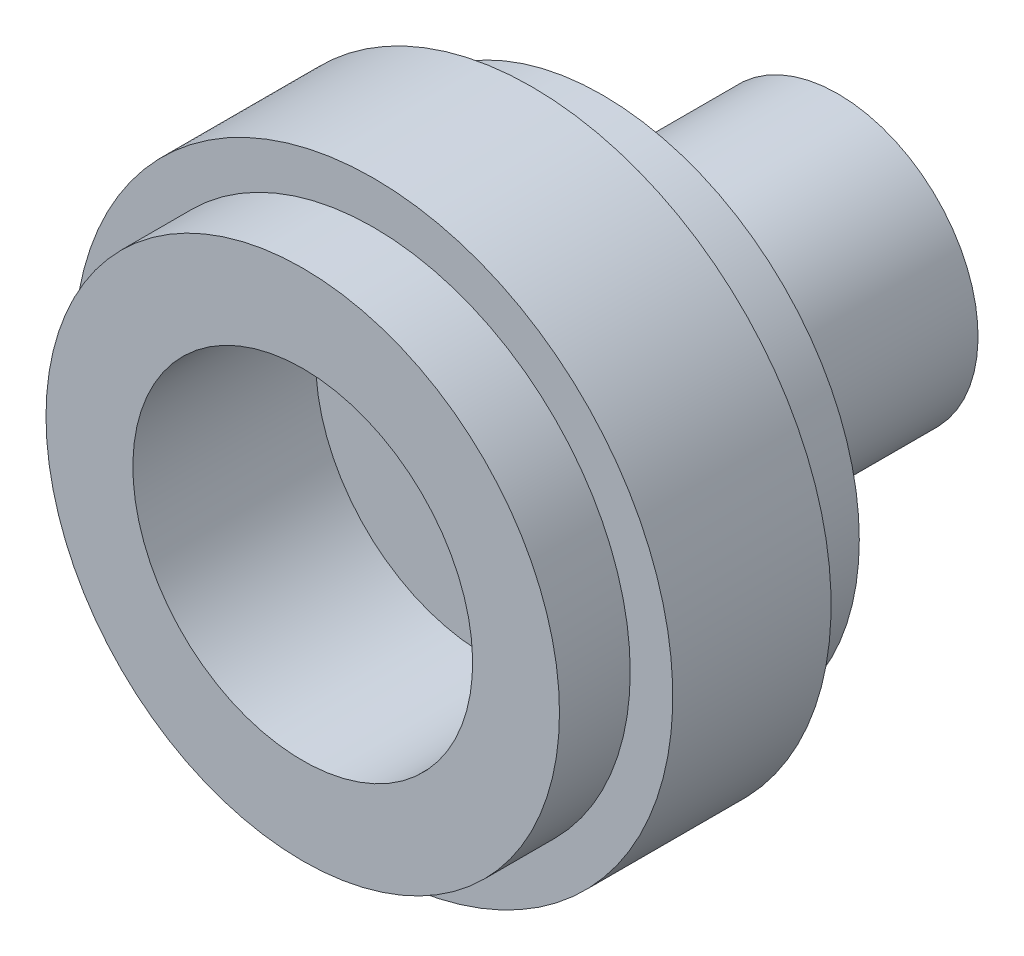
from build123d import *


with BuildPart() as part:
    # Sketch2 → Revolve1 (revolve)
    with BuildSketch(Plane(origin=(0, 0, 0), x_dir=(0, 0, -1), z_dir=(1, 0, 0))):
        Polygon((-5.4356, 6.1595), (1.1938, 6.1595), (1.1938, 1.7526), (13.97, 1.7526), (13.97, 5.08), (5.4356, 5.08), (5.4356, 9.3091), (2.8702, 9.3091), (2.8702, 10.85215), (-2.8702, 10.85215), (-2.8702, 9.3091), (-5.4356, 9.3091), align=None)
    revolve(axis=Axis((0, 0, 0), (0, 0, 1)))


solid = part.part
